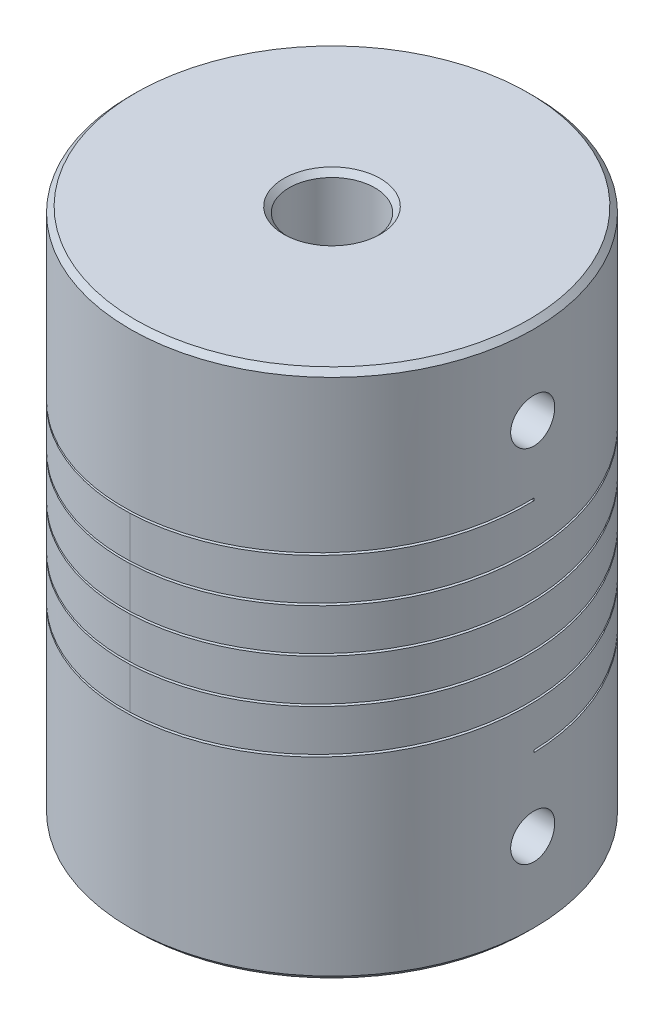
from build123d import *

# Parameters (mm, degrees)
SKETCH1_R                              = 9.398
SKETCH1_R_2                            = 2
BOSS_EXTRUDE1_DEPTH                    = 12.319
CHAMFER1_SIZE                          = 0.25
M2_5X0_45_TAPPED_HOLE1_REACH           = 31.498
M2_5X0_45_TAPPED_HOLE1_BORE_R          = 1.025
M2_5X0_45_TAPPED_HOLE1_ON_FACE_2_REACH = 31.498
M2_5X0_45_TAPPED_HOLE1_BORE_2_R        = 1.025
CUT_SWEEP3_PITCH                       = 2.032


with BuildPart() as part:
    # Sketch1 → Boss-Extrude1 (new, symmetric)
    with BuildSketch(Plane(origin=(0, 0, 0), x_dir=(1, 0, 0), z_dir=(0, 1, 0))):
        with Locations(Location((0, 0, 0), (0, 0, 90))):
            Circle(SKETCH1_R)
        with Locations(Location((0, 0, 0), (0, 0, 90))):
            Circle(SKETCH1_R_2, mode=Mode.SUBTRACT)
    extrude(amount=BOSS_EXTRUDE1_DEPTH, both=True)

    # Chamfer1
    chamfer1_edges = [part.edges().sort_by_distance(p)[0] for p in [
        (0, -12.319, 9.398),
        (0, 12.319, 9.398),
        (0, -12.319, 2),
        (0, 12.319, 2),
    ]]
    chamfer(chamfer1_edges, length=CHAMFER1_SIZE)

    # M2.5x0.45 Tapped Hole1 bore (on position points) → M2.5x0.45 Tapped Hole1 (cut, up to next)
    with BuildSketch(Plane(origin=(9.398, 8.382, 0), x_dir=(0, 1, 0), z_dir=(1, 0, 0)), mode=Mode.PRIVATE) as m2_5x0_45_tapped_hole1_sk1:
        Circle(M2_5X0_45_TAPPED_HOLE1_BORE_R)
    m2_5x0_45_tapped_hole1_tool1 = extrude(m2_5x0_45_tapped_hole1_sk1.sketch, amount=-M2_5X0_45_TAPPED_HOLE1_REACH, mode=Mode.PRIVATE) & part.part
    # M2.5x0.45 Tapped Hole1 bore (on position points) → M2.5x0.45 Tapped Hole1 (cut, up to next)
    with BuildSketch(Plane(origin=(9.398, 8.382, 0), x_dir=(0, 1, 0), z_dir=(1, 0, 0)), mode=Mode.PRIVATE) as m2_5x0_45_tapped_hole1_sk2:
        with Locations((-16.764, 0)):
            Circle(M2_5X0_45_TAPPED_HOLE1_BORE_R)
    m2_5x0_45_tapped_hole1_tool2 = extrude(m2_5x0_45_tapped_hole1_sk2.sketch, amount=-M2_5X0_45_TAPPED_HOLE1_REACH, mode=Mode.PRIVATE) & part.part
    add(m2_5x0_45_tapped_hole1_tool1.solids().sort_by_distance((9.398, 8.382, 0))[0], mode=Mode.SUBTRACT)
    add(m2_5x0_45_tapped_hole1_tool2.solids().sort_by_distance((9.398, -8.382, 0))[0], mode=Mode.SUBTRACT)

    # M2.5x0.45 Tapped Hole1 bore 2 (on position points) → M2.5x0.45 Tapped Hole1 on face 2 (cut, up to next)
    with BuildSketch(Plane(origin=(0, 8.382, -9.398), x_dir=(-1, 0, 0), z_dir=(0, 0, -1)), mode=Mode.PRIVATE) as m2_5x0_45_tapped_hole1_on_face_2_sk1:
        Circle(M2_5X0_45_TAPPED_HOLE1_BORE_2_R)
    m2_5x0_45_tapped_hole1_on_face_2_tool1 = extrude(m2_5x0_45_tapped_hole1_on_face_2_sk1.sketch, amount=-M2_5X0_45_TAPPED_HOLE1_ON_FACE_2_REACH, mode=Mode.PRIVATE) & part.part
    # M2.5x0.45 Tapped Hole1 bore 2 (on position points) → M2.5x0.45 Tapped Hole1 on face 2 (cut, up to next)
    with BuildSketch(Plane(origin=(0, 8.382, -9.398), x_dir=(-1, 0, 0), z_dir=(0, 0, -1)), mode=Mode.PRIVATE) as m2_5x0_45_tapped_hole1_on_face_2_sk2:
        with Locations((0, -16.764)):
            Circle(M2_5X0_45_TAPPED_HOLE1_BORE_2_R)
    m2_5x0_45_tapped_hole1_on_face_2_tool2 = extrude(m2_5x0_45_tapped_hole1_on_face_2_sk2.sketch, amount=-M2_5X0_45_TAPPED_HOLE1_ON_FACE_2_REACH, mode=Mode.PRIVATE) & part.part
    add(m2_5x0_45_tapped_hole1_on_face_2_tool1.solids().sort_by_distance((0, 8.382, -9.398))[0], mode=Mode.SUBTRACT)
    add(m2_5x0_45_tapped_hole1_on_face_2_tool2.solids().sort_by_distance((0, -8.382, -9.398))[0], mode=Mode.SUBTRACT)

    # Cut-Sweep3: the profile of Sketch4 profile screwed along a right-hand helix of 5 turns, 10 arcs to a turn; built about Z, then put on its axis
    cut_sweep3_z = Axis((0, 0, 0), (0, 0, 1))
    cut_sweep3_corners = [(9.398, 0, -0.0525), (1.9997, 0, -0.0525), (1.9997, 0, 0.0525), (9.398, 0, 0.0525)]
    with BuildLine(mode=Mode.PRIVATE) as cut_sweep3_profile:
        Line(cut_sweep3_corners[0], cut_sweep3_corners[1])
        Line(cut_sweep3_corners[1], cut_sweep3_corners[2])
        Line(cut_sweep3_corners[2], cut_sweep3_corners[3])
        Line(cut_sweep3_corners[3], cut_sweep3_corners[0])
    cut_sweep3_cap = Face(cut_sweep3_profile.wire())
    cut_sweep3_turn_angles = [0, 18, 36, 54, 72, 90, 108, 126, 144, 162, 180, 198, 216, 234, 252, 270, 288, 306, 324, 342, 360]
    cut_sweep3_turn_weights = [1, 0.9510565162951535, 1, 0.9510565162951535, 1, 0.9510565162951535, 1, 0.9510565162951535, 1, 0.9510565162951535, 1, 0.9510565162951535, 1, 0.9510565162951535, 1, 0.9510565162951535, 1, 0.9510565162951535, 1, 0.9510565162951535, 1]
    cut_sweep3_turn_rails = [Edge.make_bspline([Vector(p[0], p[1], 0).rotate(cut_sweep3_z, cut_sweep3_turn_angles[k]) / cut_sweep3_turn_weights[k] + Vector(0, 0, p[2] + CUT_SWEEP3_PITCH * cut_sweep3_turn_angles[k] / 360) for k in range(21)], [0, 0, 0, 1, 1, 2, 2, 3, 3, 4, 4, 5, 5, 6, 6, 7, 7, 8, 8, 9, 9, 10, 10, 10], 2, cut_sweep3_turn_weights) for p in cut_sweep3_corners]
    cut_sweep3_turn_sides = [Face.make_surface_from_curves(cut_sweep3_turn_rails[p[0]], cut_sweep3_turn_rails[p[1]]) for p in [(0, 1), (1, 2), (2, 3), (3, 0)]]
    cut_sweep3 = Plane(origin=(0, -4.953, 0), x_dir=(1, 0, 0), z_dir=(0, 1, 0)) * Solid(Shell([*[p.moved(Location((0, 0, CUT_SWEEP3_PITCH * i))) for i in range(5) for p in cut_sweep3_turn_sides], cut_sweep3_cap, cut_sweep3_cap.rotate(cut_sweep3_z, 1800).moved(Location((0, 0, CUT_SWEEP3_PITCH * 1800 / 360)))]))
    add(cut_sweep3, mode=Mode.SUBTRACT)


solid = part.part
